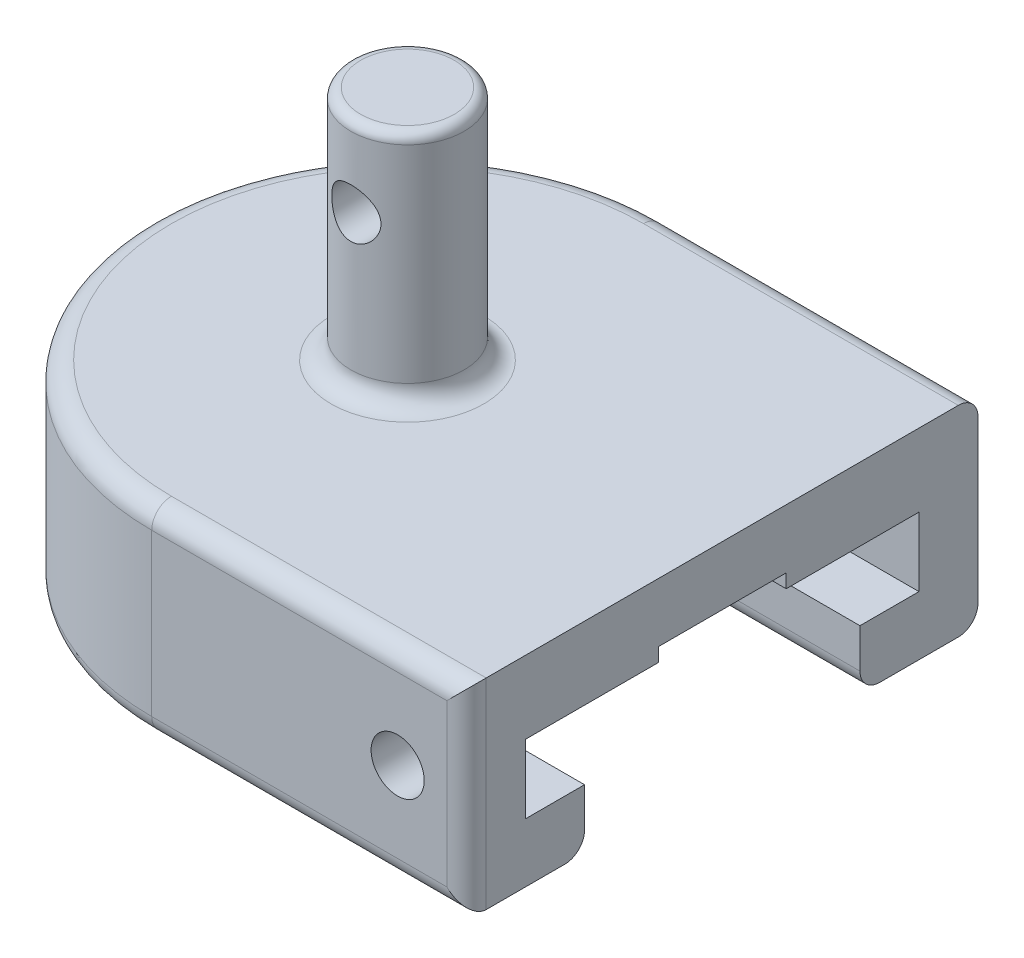
from build123d import *

# Parameters (mm, degrees)
BOSS_EXTRUDE1_DEPTH   = 3
BOSS_EXTRUDE2_DEPTH   = 3.5
BOSS_EXTRUDE3_DEPTH   = 3.7
SKETCH4_R             = 2.88
BOSS_EXTRUDE4_DEPTH   = 12
SKETCH9_W             = 6.5
SKETCH9_H             = 0.7
CUT_EXTRUDE2_DEPTH    = 23
F_2_5MM_DOWEL_HOLE1_D = 2.5
SKETCH8_R             = 1.35
CUT_EXTRUDE1_DEPTH    = 38.747052924
FILLET1_R             = 1
FILLET2_R             = 1
FILLET3_R             = 0.5


with BuildPart() as part:
    # Sketch1 → Boss-Extrude1 (new body)
    with BuildSketch(Plane(origin=(0, 0, 0), x_dir=(1, 0, 0), z_dir=(0, 1, 0))):
        with BuildLine():
            Line((0, 13), (16, 13))
            Line((16, 13), (16, 7))
            Line((16, 7), (0, 7))
            ThreePointArc((0, 7), (-7, 0), (0, -7))
            Line((0, -7), (16, -7))
            Line((16, -7), (16, -13))
            Line((16, -13), (0, -13))
            ThreePointArc((0, -13), (-13, 0), (0, 13))
        make_face()
    extrude(amount=BOSS_EXTRUDE1_DEPTH)

    # Sketch2 → Boss-Extrude2 (add)
    with BuildSketch(Plane(origin=(0, 3, 0), x_dir=(1, 0, 0), z_dir=(0, 1, 0))):
        with BuildLine():
            Line((0, 13), (16, 13))
            Line((16, 13), (16, 10))
            Line((16, 10), (0, 10))
            ThreePointArc((0, 10), (-10, 0), (0, -10))
            Line((0, -10), (16, -10))
            Line((16, -10), (16, -13))
            Line((16, -13), (0, -13))
            ThreePointArc((0, -13), (-13, 0), (0, 13))
        make_face()
    extrude(amount=BOSS_EXTRUDE2_DEPTH)

    # Sketch3 → Boss-Extrude3 (add)
    with BuildSketch(Plane(origin=(0, 6.5, 0), x_dir=(1, 0, 0), z_dir=(0, 1, 0))):
        with BuildLine():
            Line((16, 13), (0, 13))
            ThreePointArc((0, 13), (-13, 0), (0, -13))
            Line((0, -13), (16, -13))
            Line((16, -13), (16, -7))
            Line((16, -7), (16, 7))
            Line((16, 7), (16, 13))
        make_face()
    extrude(amount=BOSS_EXTRUDE3_DEPTH)

    # Sketch4 → Boss-Extrude4 (add)
    with BuildSketch(Plane(origin=(0, 10.2, 0), x_dir=(1, 0, 0), z_dir=(0, 1, 0))):
        Circle(SKETCH4_R)
    extrude(amount=BOSS_EXTRUDE4_DEPTH)

    # Sketch9 → Cut-Extrude2 (cut)
    with BuildSketch(Plane(origin=(16, 0, 0), x_dir=(0, 0, -1), z_dir=(1, 0, 0))):
        with Locations((0, 6.85)):
            Rectangle(SKETCH9_W, SKETCH9_H)
    extrude(amount=-CUT_EXTRUDE2_DEPTH, mode=Mode.SUBTRACT)

    # Ø2.5mm Dowel Hole1 (through all)
    with Locations(Plane(origin=(-0.002429038, 18.104937254, 2.879998976), x_dir=(0.999999644325, 0, 0.000843415861), z_dir=(-0.000843415861, 0, 0.999999644325))):
        with Locations((0, 0)):
            Hole(F_2_5MM_DOWEL_HOLE1_D / 2)

    # Sketch8 → Cut-Extrude1 (cut, through all)
    with BuildSketch(Plane.XY.offset(13)):
        with Locations((12.5, 5.1)):
            Circle(SKETCH8_R)
    extrude(amount=-CUT_EXTRUDE1_DEPTH, mode=Mode.SUBTRACT)

    # Fillet1
    fillet1_edges = [part.edges().sort_by_distance(p)[0] for p in [
        (8, 10.2, -13),
        (-13, 10.2, 0),
        (8, 0, -13),
        (-13, 0, 0),
        (8, 10.2, 13),
        (16, 5.1, 13),
        (8, 0, 13),
        (8, 0, -7),
        (-7, 0, 0),
        (8, 0, 7),
    ]]
    fillet(fillet1_edges, radius=FILLET1_R)

    # Fillet2
    fillet2_edges = [part.edges().sort_by_distance(p)[0] for p in [
        (-2.88, 10.2, 0),
    ]]
    fillet(fillet2_edges, radius=FILLET2_R)

    # Fillet3
    fillet3_edges = [part.edges().sort_by_distance(p)[0] for p in [
        (-2.88, 22.2, 0),
    ]]
    fillet(fillet3_edges, radius=FILLET3_R)


solid = part.part
